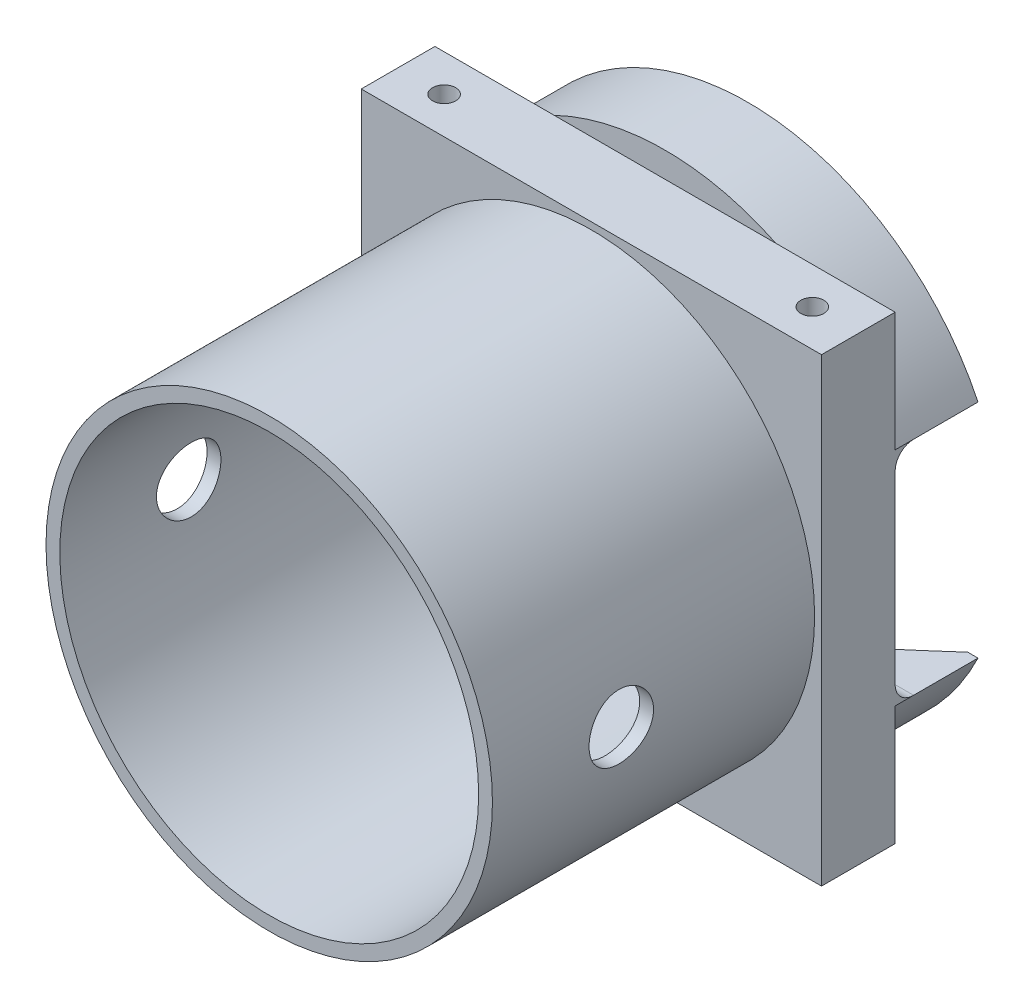
from build123d import *
from build123d.topology import SkipClean

# Parameters (mm, degrees)
SKETCH_1_R                  = 24.250000000000004
SKETCH_1_R_2                = 22.75
EXTRUDE_1_DEPTH             = 35
EXTRUDE_START               = 8
SKETCH_2_R                  = 22.75
EXTRUDE_2_DEPTH             = 8
HOLE_WIZARD_M3_1_AT_2_COUNT = 2
HOLE_WIZARD_M3_1_AT_2_PITCH = 40
EXTRUDE_START_2             = 9
EXTRUDE_3_DEPTH             = 9
CUT_EXTRUDE_1_DEPTH         = 52.18654608390758
CUT_EXTRUDE_1_DEPTH_BACK    = 52.18654608390758
SKETCH_6_R                  = 3.5
CHAMFER_2_SIZE              = 4
FILLET_1_R                  = 2


with BuildPart() as part:
    # 草图1 → 凸台-拉伸1 (new body)
    with BuildSketch(Plane.XY):
        Circle(SKETCH_1_R)
        Circle(SKETCH_1_R_2, mode=Mode.SUBTRACT)
    extrude(amount=EXTRUDE_1_DEPTH)

    # 草图2 → 凸台-拉伸2 (add)
    with SkipClean():  # the faces are left unmerged after this step: merging them gives an invalid solid
        with BuildSketch(Plane(origin=(0, 0, 0), x_dir=(-1, 0, 0), z_dir=(0, 0, -1)).offset(EXTRUDE_START)):
            Polygon((-24.999999999999883, -24.999999999999883), (24.999999999999876, -24.999999999999883), (24.999999999999883, 24.999999999999876), (-24.999999999999883, 24.999999999999876), align=None)
            Circle(SKETCH_2_R, mode=Mode.SUBTRACT)
        extrude(amount=-EXTRUDE_2_DEPTH)

    # 草图4 → M3 螺纹孔1 (revolve, cut)
    with SkipClean():  # the faces are left unmerged after this step: merging them gives an invalid solid
        with BuildSketch(Plane(origin=(-20, 24.999999999999876, -4), x_dir=(0, 0, 1), z_dir=(1, 0, 0))):
            Polygon((0, 0), (-1.9e-15, 7.75107577378445), (1.249999999999998, 6.999999999999999), (1.249999999999989, -1.4e-15), align=None)
        hole_wizard_m3_1 = revolve(axis=Axis((-20, 31.349999999999866, -4), (0, -1, 0)), mode=Mode.SUBTRACT)

    # M3 螺纹孔1 at 2: M3 螺纹孔1 ×2
    with SkipClean():  # the faces are left unmerged after this step: merging them gives an invalid solid
        with Locations(*[(i * HOLE_WIZARD_M3_1_AT_2_PITCH, 0, 0) for i in range(1, HOLE_WIZARD_M3_1_AT_2_COUNT)]):
            add(hole_wizard_m3_1, mode=Mode.SUBTRACT)

    # 草图5 → 凸台-拉伸3 (add)
    with SkipClean():  # the faces are left unmerged after this step: merging them gives an invalid solid
        with BuildSketch(Plane(origin=(0, 0, -8), x_dir=(-1, 0, 0), z_dir=(0, 0, -1)).offset(EXTRUDE_START_2)):
            with BuildLine():
                Line((-24.999999999999883, -12.044189470446147), (-19.30025906561863, -12.044189470446147))
                ThreePointArc((-19.30025906561863, -12.044189470446147), (1.39e-15, -22.75), (19.30025906561863, -12.044189470446147))
                Line((19.30025906561863, -12.044189470446147), (24.999999999999883, -12.044189470446147))
                ThreePointArc((24.999999999999883, -12.044189470446147), (1.7e-15, -27.75), (-24.999999999999883, -12.044189470446147))
            make_face()
            with BuildLine():
                Line((24.999999999999883, 12.044189470446147), (19.300259065618633, 12.044189470446147))
                ThreePointArc((19.300259065618633, 12.044189470446147), (6.44e-15, 22.749999999999975), (-19.3002590656186, 12.044189470446147))
                Line((-19.3002590656186, 12.044189470446147), (-24.999999999999854, 12.044189470446147))
                ThreePointArc((-24.999999999999854, 12.044189470446147), (7.86e-15, 27.749999999999975), (24.999999999999883, 12.044189470446147))
            make_face()
        extrude(amount=-EXTRUDE_3_DEPTH)

    # 草图6 → 切除-拉伸1 (cut, two sides: drawn at the far end of the back side and taken through both)
    with SkipClean():  # the faces are left unmerged after this step: merging them gives an invalid solid
        with BuildSketch(Plane(origin=(0, 0, 0), x_dir=(0, 0, -1), z_dir=(1, 0, 0)).offset(-CUT_EXTRUDE_1_DEPTH_BACK)):
            with Locations((-20.999999999999996, 0)):
                Circle(SKETCH_6_R)
        extrude(amount=CUT_EXTRUDE_1_DEPTH + CUT_EXTRUDE_1_DEPTH_BACK, mode=Mode.SUBTRACT)

    # 倒角2
    chamfer_2_edges = [part.edges().sort_by_distance(p)[0] for p in [
        (0, -22.75, -17),
        (-1.599e-14, 22.74999999999998, -17),
    ]]
    chamfer(chamfer_2_edges, length=CHAMFER_2_SIZE)

    # 圆角1
    # the kernel refuses this fillet: 2 mm, written as the material it adds along each edge
    with BuildSketch(Plane(origin=(-14.30025906561863, -12.044189470446147, -8), x_dir=(0, 1, 0), z_dir=(-1, 0, 0))) as fillet_1_piece_1_section:
        with BuildLine():
            CenterArc((FILLET_1_R, FILLET_1_R), FILLET_1_R, 180, 90)
            Line((0, FILLET_1_R), (0, 0))
            Line((0, 0), (FILLET_1_R, 0))
        make_face()
    fillet_1_piece_1 = extrude(amount=10.699740934381254, mode=Mode.PRIVATE)
    fillet_1_piece_1 = fillet_1_piece_1 - Plane(origin=(0, 0, -8.464512968517406), x_dir=(-1, 0, 0), z_dir=(0, 0, -1)) * Cylinder(22.75, 30, mode=Mode.PRIVATE)
    fillet_1_piece_1 = fillet_1_piece_1 & Plane(origin=(0, 0, -8.464512968517406), x_dir=(-0.9009009009008967, -0.43402484578184314, 0), z_dir=(0, 0, -1)) * Cylinder(27.75, 30, mode=Mode.PRIVATE)
    add(fillet_1_piece_1)
    with BuildSketch(Plane(origin=(24.999999999999883, -12.044189470446147, -8), x_dir=(0, 1, 0), z_dir=(-1, 0, 0))) as fillet_1_piece_2_section:
        with BuildLine():
            CenterArc((FILLET_1_R, FILLET_1_R), FILLET_1_R, 180, 90)
            Line((0, FILLET_1_R), (0, 0))
            Line((0, 0), (FILLET_1_R, 0))
        make_face()
    fillet_1_piece_2 = extrude(amount=10.699740934381254, mode=Mode.PRIVATE)
    fillet_1_piece_2 = fillet_1_piece_2 - Plane(origin=(0, 0, -8.464511682363383), x_dir=(-1, 0, 0), z_dir=(0, 0, -1)) * Cylinder(22.75, 30, mode=Mode.PRIVATE)
    fillet_1_piece_2 = fillet_1_piece_2 & Plane(origin=(0, 0, -8.464511682363383), x_dir=(-0.9009009009008967, -0.43402484578184314, 0), z_dir=(0, 0, -1)) * Cylinder(27.75, 30, mode=Mode.PRIVATE)
    add(fillet_1_piece_2)
    with BuildSketch(Plane(origin=(14.3002590656186, 12.044189470446147, -8), x_dir=(0, 0, -1), z_dir=(1, 0, 0))) as fillet_1_piece_3_section:
        with BuildLine():
            CenterArc((FILLET_1_R, -FILLET_1_R), FILLET_1_R, 90, 90)
            Line((0, -FILLET_1_R), (0, 0))
            Line((0, 0), (FILLET_1_R, 0))
        make_face()
    fillet_1_piece_3 = extrude(amount=10.699740934381254, mode=Mode.PRIVATE)
    fillet_1_piece_3 = fillet_1_piece_3 - Plane(origin=(-1.599e-14, -3.197e-14, -8.464512428813396), x_dir=(-0.8483630358513676, 0.5294149217778539, 0), z_dir=(0, 0, -1)) * Cylinder(22.75000000000001, 30, mode=Mode.PRIVATE)
    fillet_1_piece_3 = fillet_1_piece_3 & Plane(origin=(-1.421e-14, -2.487e-14, -8.464512428813396), x_dir=(0.9009009009008963, 0.4340248457818441, 0), z_dir=(0, 0, -1)) * Cylinder(27.75, 30, mode=Mode.PRIVATE)
    add(fillet_1_piece_3)
    with BuildSketch(Plane(origin=(-24.999999999999883, 12.044189470446147, -8), x_dir=(0, 0, -1), z_dir=(1, 0, 0))) as fillet_1_piece_4_section:
        with BuildLine():
            CenterArc((FILLET_1_R, -FILLET_1_R), FILLET_1_R, 90, 90)
            Line((0, -FILLET_1_R), (0, 0))
            Line((0, 0), (FILLET_1_R, 0))
        make_face()
    fillet_1_piece_4 = extrude(amount=10.69974093438125, mode=Mode.PRIVATE)
    fillet_1_piece_4 = fillet_1_piece_4 - Plane(origin=(-1.599e-14, -3.197e-14, -8.464512598097409), x_dir=(-0.8483630358513676, 0.5294149217778539, 0), z_dir=(0, 0, -1)) * Cylinder(22.75000000000001, 30, mode=Mode.PRIVATE)
    fillet_1_piece_4 = fillet_1_piece_4 & Plane(origin=(-1.421e-14, -2.487e-14, -8.464512598097409), x_dir=(0.9009009009008963, 0.4340248457818441, 0), z_dir=(0, 0, -1)) * Cylinder(27.75, 30, mode=Mode.PRIVATE)
    add(fillet_1_piece_4)

    # 镜向1: M3 螺纹孔1 across plane
    add(hole_wizard_m3_1.mirror(Plane.ZX), mode=Mode.SUBTRACT)

    # 镜向1 copy 1 sketch → 镜向1 copy 1 (revolve, cut)
    with BuildSketch(Plane(origin=(20, -24.999999999999876, -4), x_dir=(0, 0, 1), z_dir=(1, 0, 0))):
        Polygon((0, 0), (-1.9e-15, -7.75107577378445), (1.249999999999998, -6.999999999999999), (1.249999999999989, 1.4e-15), align=None)
    revolve(axis=Axis((20, -31.349999999999866, -4), (0, -1, 0)), mode=Mode.SUBTRACT)


solid = part.part
